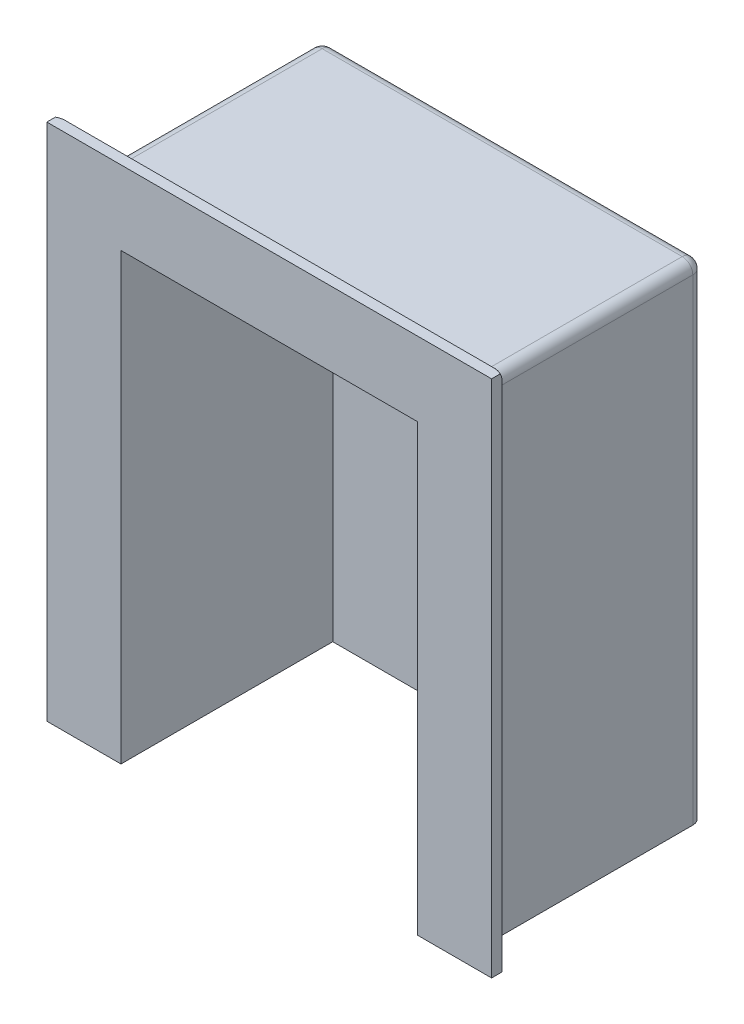
from build123d import *

# Parameters (mm, degrees)
SKETCH1_W           = 14
SKETCH1_H           = 21
BOSS_EXTRUDE1_DEPTH = 1.5
BOSS_EXTRUDE2_DEPTH = 11.5
BOSS_EXTRUDE3_DEPTH = 0.5
CHAMFER1_SIZE       = 1.5
FILLET1_R           = 0.5


# Some blends are built 0.0001 mm under size
with BuildPart() as part:
    # Sketch1 → Boss-Extrude1 (new body)
    with BuildSketch(Plane.XY):
        Rectangle(SKETCH1_W, SKETCH1_H)
    extrude(amount=BOSS_EXTRUDE1_DEPTH)

    # Sketch1<4> → Boss-Extrude2 (add)
    with BuildSketch(Plane.XY):
        Polygon((-9, 12.5), (-9, -10.5), (-7, -10.5), (-7, 10.5), (7, 10.5), (7, -10.5), (9, -10.5), (9, 12.5), align=None)
    extrude(amount=BOSS_EXTRUDE2_DEPTH)

    # Sketch2 → Boss-Extrude3 (add)
    with BuildSketch(Plane.XY.offset(11.5)):
        Polygon((-9, -10.5), (-9, 12.5), (9, 12.5), (9, -10.5), (10.5, -10.5), (10.5, 14), (-10.5, 14), (-10.5, -10.5), align=None)
    extrude(amount=-BOSS_EXTRUDE3_DEPTH)

    # Chamfer1
    chamfer1_edges = [part.edges().sort_by_distance(p)[0] for p in [
        (-9, 1, 11),
        (0, 12.5, 11),
        (9, 1, 11),
    ]]
    chamfer(chamfer1_edges, length=CHAMFER1_SIZE - 0.0001)  # a hair under: the kernel refuses the full size

    # Fillet1
    # the kernel refuses this fillet: 0.5 mm, written as the material it takes off along each edge
    with BuildSketch(Plane(origin=(8.5, 12, 0.5), x_dir=(0, 0, -1), z_dir=(0, 1, 0))) as fillet1_piece_1_section:
        Polygon((0, 0), (FILLET1_R * 1.02, 0), (FILLET1_R * 1.02, -FILLET1_R * 1.02), (0, -FILLET1_R * 1.02), align=None)
    fillet1_piece_1 = extrude(amount=FILLET1_R * 1.02, mode=Mode.PRIVATE)
    fillet1_piece_1 = fillet1_piece_1 - Plane(origin=(8.5, 12, 0.5), x_dir=(-0.7071067811865475, 0, 0.7071067811865475), z_dir=(0, 1, 0)) * Sphere(FILLET1_R, mode=Mode.PRIVATE)
    add(fillet1_piece_1, mode=Mode.SUBTRACT)
    with BuildSketch(Plane(origin=(-8.5, 12, 0.5), x_dir=(0, 0, -1), z_dir=(-1, 0, 0))) as fillet1_piece_2_section:
        Polygon((0, 0), (FILLET1_R * 1.02, 0), (FILLET1_R * 1.02, -FILLET1_R * 1.02), (0, -FILLET1_R * 1.02), align=None)
    fillet1_piece_2 = extrude(amount=FILLET1_R * 1.02, mode=Mode.PRIVATE)
    fillet1_piece_2 = fillet1_piece_2 - Plane(origin=(-8.5, 12, 0.5), x_dir=(0, -0.7071067811865475, 0.7071067811865475), z_dir=(-1, 0, 0)) * Sphere(FILLET1_R, mode=Mode.PRIVATE)
    add(fillet1_piece_2, mode=Mode.SUBTRACT)
    with BuildSketch(Plane(origin=(9, -11.75, 0), x_dir=(-1, 0, 0), z_dir=(0, 1, 0))) as fillet1_piece_3:
        with BuildLine():
            CenterArc((FILLET1_R, FILLET1_R), FILLET1_R, 180, 90)
            Line((0, FILLET1_R), (-FILLET1_R * 0.02, FILLET1_R))
            Line((-FILLET1_R * 0.02, FILLET1_R), (-FILLET1_R * 0.02, -FILLET1_R * 0.02))
            Line((-FILLET1_R * 0.02, -FILLET1_R * 0.02), (FILLET1_R, -FILLET1_R * 0.02))
            Line((FILLET1_R, -FILLET1_R * 0.02), (FILLET1_R, 0))
        make_face()
    extrude(amount=23.75, mode=Mode.SUBTRACT)
    with BuildSketch(Plane(origin=(-9, 12, 0), x_dir=(0, 0, 1), z_dir=(0, -1, 0))) as fillet1_piece_4:
        with BuildLine():
            CenterArc((FILLET1_R, -FILLET1_R), FILLET1_R, 90, 90)
            Line((0, -FILLET1_R), (-FILLET1_R * 0.02, -FILLET1_R))
            Line((-FILLET1_R * 0.02, -FILLET1_R), (-FILLET1_R * 0.02, FILLET1_R * 0.02))
            Line((-FILLET1_R * 0.02, FILLET1_R * 0.02), (FILLET1_R, FILLET1_R * 0.02))
            Line((FILLET1_R, FILLET1_R * 0.02), (FILLET1_R, 0))
        make_face()
    extrude(amount=23.75, mode=Mode.SUBTRACT)
    with BuildSketch(Plane(origin=(8.5, 12.5, 0), x_dir=(0, -1, 0), z_dir=(-1, 0, 0))) as fillet1_piece_5:
        with BuildLine():
            CenterArc((FILLET1_R, FILLET1_R), FILLET1_R, 180, 90)
            Line((0, FILLET1_R), (-FILLET1_R * 0.02, FILLET1_R))
            Line((-FILLET1_R * 0.02, FILLET1_R), (-FILLET1_R * 0.02, -FILLET1_R * 0.02))
            Line((-FILLET1_R * 0.02, -FILLET1_R * 0.02), (FILLET1_R, -FILLET1_R * 0.02))
            Line((FILLET1_R, -FILLET1_R * 0.02), (FILLET1_R, 0))
        make_face()
    extrude(amount=17, mode=Mode.SUBTRACT)
    with BuildSketch(Plane(origin=(-9, 12.5, 0.5), x_dir=(0, -1, 0), z_dir=(0, 0, 1))) as fillet1_piece_6_section:
        with BuildLine():
            CenterArc((FILLET1_R, FILLET1_R), FILLET1_R, 180, 90)
            Line((0, FILLET1_R), (-FILLET1_R * 0.02, FILLET1_R))
            Line((-FILLET1_R * 0.02, FILLET1_R), (-FILLET1_R * 0.02, -FILLET1_R * 0.02))
            Line((-FILLET1_R * 0.02, -FILLET1_R * 0.02), (FILLET1_R, -FILLET1_R * 0.02))
            Line((FILLET1_R, -FILLET1_R * 0.02), (FILLET1_R, 0))
        make_face()
    fillet1_piece_6 = extrude(amount=10.2501, mode=Mode.PRIVATE)
    fillet1_piece_6 = split(fillet1_piece_6, bisect_by=Plane(origin=(-6.646616443, 12.387329395, 7.146716443), z_dir=(-0.7071067811865476, 0, -0.7071067811865476)), keep=Keep.TOP, mode=Mode.PRIVATE)
    fillet1_piece_6 = split(fillet1_piece_6, bisect_by=Plane(origin=(-8.887329395, 10.146616443, 7.146716443), z_dir=(0, 0.7071067811865476, -0.7071067811865476)), keep=Keep.TOP, mode=Mode.PRIVATE)
    add(fillet1_piece_6, mode=Mode.SUBTRACT)
    with BuildSketch(Plane(origin=(-9, 12.5, 0.5), x_dir=(0, -1, 0), z_dir=(0, 0, 1))) as fillet1_piece_7_section:
        with BuildLine():
            CenterArc((FILLET1_R, FILLET1_R), FILLET1_R, 180, 90)
            Line((0, FILLET1_R), (-FILLET1_R * 0.02, FILLET1_R))
            Line((-FILLET1_R * 0.02, FILLET1_R), (-FILLET1_R * 0.02, -FILLET1_R * 0.02))
            Line((-FILLET1_R * 0.02, -FILLET1_R * 0.02), (FILLET1_R, -FILLET1_R * 0.02))
            Line((FILLET1_R, -FILLET1_R * 0.02), (FILLET1_R, 0))
        make_face()
    fillet1_piece_7 = extrude(amount=10.2501, mode=Mode.PRIVATE)
    fillet1_piece_7 = split(fillet1_piece_7, bisect_by=Plane(origin=(-8.796279433, 12.478509021, 9.296379433), z_dir=(0.7071067811865476, 0, 0.7071067811865476)), keep=Keep.TOP, mode=Mode.PRIVATE)
    fillet1_piece_7 = split(fillet1_piece_7, bisect_by=Plane(origin=(-8.735536236, 12.417765825, 9.417865825), z_dir=(0, 0.7071067811865476, -0.7071067811865476)), keep=Keep.TOP, mode=Mode.PRIVATE)
    add(fillet1_piece_7, mode=Mode.SUBTRACT)
    with BuildSketch(Plane(origin=(-9, 12.5, 0.5), x_dir=(0, -1, 0), z_dir=(0, 0, 1))) as fillet1_piece_8_section:
        with BuildLine():
            CenterArc((FILLET1_R, FILLET1_R), FILLET1_R, 180, 90)
            Line((0, FILLET1_R), (-FILLET1_R * 0.02, FILLET1_R))
            Line((-FILLET1_R * 0.02, FILLET1_R), (-FILLET1_R * 0.02, -FILLET1_R * 0.02))
            Line((-FILLET1_R * 0.02, -FILLET1_R * 0.02), (FILLET1_R, -FILLET1_R * 0.02))
            Line((FILLET1_R, -FILLET1_R * 0.02), (FILLET1_R, 0))
        make_face()
    fillet1_piece_8 = extrude(amount=10.2501, mode=Mode.PRIVATE)
    fillet1_piece_8 = split(fillet1_piece_8, bisect_by=Plane(origin=(-8.917765825, 12.235536236, 9.417865825), z_dir=(-0.7071067811865476, 0, -0.7071067811865476)), keep=Keep.TOP, mode=Mode.PRIVATE)
    fillet1_piece_8 = split(fillet1_piece_8, bisect_by=Plane(origin=(-8.978509021, 12.296279433, 9.296379433), z_dir=(0, -0.7071067811865476, 0.7071067811865476)), keep=Keep.TOP, mode=Mode.PRIVATE)
    add(fillet1_piece_8, mode=Mode.SUBTRACT)
    with BuildSketch(Plane(origin=(9, 12.5, 0.5), x_dir=(0, -1, 0), z_dir=(0, 0, 1))) as fillet1_piece_9_section:
        with BuildLine():
            CenterArc((FILLET1_R, -FILLET1_R), FILLET1_R, 90, 90)
            Line((0, -FILLET1_R), (-FILLET1_R * 0.02, -FILLET1_R))
            Line((-FILLET1_R * 0.02, -FILLET1_R), (-FILLET1_R * 0.02, FILLET1_R * 0.02))
            Line((-FILLET1_R * 0.02, FILLET1_R * 0.02), (FILLET1_R, FILLET1_R * 0.02))
            Line((FILLET1_R, FILLET1_R * 0.02), (FILLET1_R, 0))
        make_face()
    fillet1_piece_9 = extrude(amount=10.2501, mode=Mode.PRIVATE)
    fillet1_piece_9 = split(fillet1_piece_9, bisect_by=Plane(origin=(6.646616443, 12.387329395, 7.146716443), z_dir=(0.7071067811865476, 0, -0.7071067811865476)), keep=Keep.TOP, mode=Mode.PRIVATE)
    fillet1_piece_9 = split(fillet1_piece_9, bisect_by=Plane(origin=(8.887329395, 10.146616443, 7.146716443), z_dir=(0, 0.7071067811865476, -0.7071067811865476)), keep=Keep.TOP, mode=Mode.PRIVATE)
    add(fillet1_piece_9, mode=Mode.SUBTRACT)
    with BuildSketch(Plane(origin=(9, 12.5, 0.5), x_dir=(0, -1, 0), z_dir=(0, 0, 1))) as fillet1_piece_10_section:
        with BuildLine():
            CenterArc((FILLET1_R, -FILLET1_R), FILLET1_R, 90, 90)
            Line((0, -FILLET1_R), (-FILLET1_R * 0.02, -FILLET1_R))
            Line((-FILLET1_R * 0.02, -FILLET1_R), (-FILLET1_R * 0.02, FILLET1_R * 0.02))
            Line((-FILLET1_R * 0.02, FILLET1_R * 0.02), (FILLET1_R, FILLET1_R * 0.02))
            Line((FILLET1_R, FILLET1_R * 0.02), (FILLET1_R, 0))
        make_face()
    fillet1_piece_10 = extrude(amount=10.2501, mode=Mode.PRIVATE)
    fillet1_piece_10 = split(fillet1_piece_10, bisect_by=Plane(origin=(8.796279433, 12.478509021, 9.296379433), z_dir=(-0.7071067811865476, 0, 0.7071067811865476)), keep=Keep.TOP, mode=Mode.PRIVATE)
    fillet1_piece_10 = split(fillet1_piece_10, bisect_by=Plane(origin=(8.735536236, 12.417765825, 9.417865825), z_dir=(0, 0.7071067811865476, -0.7071067811865476)), keep=Keep.TOP, mode=Mode.PRIVATE)
    add(fillet1_piece_10, mode=Mode.SUBTRACT)
    with BuildSketch(Plane(origin=(9, 12.5, 0.5), x_dir=(0, -1, 0), z_dir=(0, 0, 1))) as fillet1_piece_11_section:
        with BuildLine():
            CenterArc((FILLET1_R, -FILLET1_R), FILLET1_R, 90, 90)
            Line((0, -FILLET1_R), (-FILLET1_R * 0.02, -FILLET1_R))
            Line((-FILLET1_R * 0.02, -FILLET1_R), (-FILLET1_R * 0.02, FILLET1_R * 0.02))
            Line((-FILLET1_R * 0.02, FILLET1_R * 0.02), (FILLET1_R, FILLET1_R * 0.02))
            Line((FILLET1_R, FILLET1_R * 0.02), (FILLET1_R, 0))
        make_face()
    fillet1_piece_11 = extrude(amount=10.2501, mode=Mode.PRIVATE)
    fillet1_piece_11 = split(fillet1_piece_11, bisect_by=Plane(origin=(8.917765825, 12.235536236, 9.417865825), z_dir=(0.7071067811865476, 0, -0.7071067811865476)), keep=Keep.TOP, mode=Mode.PRIVATE)
    fillet1_piece_11 = split(fillet1_piece_11, bisect_by=Plane(origin=(8.978509021, 12.296279433, 9.296379433), z_dir=(0, -0.7071067811865476, 0.7071067811865476)), keep=Keep.TOP, mode=Mode.PRIVATE)
    add(fillet1_piece_11, mode=Mode.SUBTRACT)
    with BuildSketch(Plane(origin=(8.583333333, 12.083333333, 9.083433333), x_dir=(0.408248290463863, -0.816496580927726, 0.408248290463863), z_dir=(0.5773502691896258, 0.5773502691896258, 0.5773502691896258))) as fillet1_piece_12_section:
        with BuildLine():
            CenterArc((FILLET1_R * 0.57735026919, -FILLET1_R), FILLET1_R, 90, 60)
            Line((-FILLET1_R * 0.288675134595, -FILLET1_R * 0.5), (-FILLET1_R * 0.305995642671, -FILLET1_R * 0.49))
            Line((-FILLET1_R * 0.305995642671, -FILLET1_R * 0.49), (-FILLET1_R * 0.0115470053838, FILLET1_R * 0.02))
            Line((-FILLET1_R * 0.0115470053838, FILLET1_R * 0.02), (FILLET1_R * 0.57735026919, FILLET1_R * 0.02))
            Line((FILLET1_R * 0.57735026919, FILLET1_R * 0.02), (FILLET1_R * 0.57735026919, 0))
        make_face()
    fillet1_piece_12 = extrude(amount=4.041278679, mode=Mode.PRIVATE)
    fillet1_piece_12 = split(fillet1_piece_12, bisect_by=Plane(origin=(9, 12.593724218, 9.60103013), z_dir=(-1, 0, 0)), keep=Keep.TOP, mode=Mode.PRIVATE)
    fillet1_piece_12 = split(fillet1_piece_12, bisect_by=Plane(origin=(8.906275782, 12.5, 9.60103013), z_dir=(0, 1, 0)), keep=Keep.TOP, mode=Mode.PRIVATE)
    add(fillet1_piece_12, mode=Mode.SUBTRACT)
    with BuildSketch(Plane(origin=(8.583333333, 12.083333333, 9.083433333), x_dir=(0.408248290463863, -0.816496580927726, 0.408248290463863), z_dir=(0.5773502691896258, 0.5773502691896258, 0.5773502691896258))) as fillet1_piece_13_section:
        with BuildLine():
            CenterArc((FILLET1_R * 0.57735026919, -FILLET1_R), FILLET1_R, 90, 60)
            Line((-FILLET1_R * 0.288675134595, -FILLET1_R * 0.5), (-FILLET1_R * 0.305995642671, -FILLET1_R * 0.49))
            Line((-FILLET1_R * 0.305995642671, -FILLET1_R * 0.49), (-FILLET1_R * 0.0115470053838, FILLET1_R * 0.02))
            Line((-FILLET1_R * 0.0115470053838, FILLET1_R * 0.02), (FILLET1_R * 0.57735026919, FILLET1_R * 0.02))
            Line((FILLET1_R * 0.57735026919, FILLET1_R * 0.02), (FILLET1_R * 0.57735026919, 0))
        make_face()
    fillet1_piece_13 = extrude(amount=4.041278679, mode=Mode.PRIVATE)
    fillet1_piece_13 = split(fillet1_piece_13, bisect_by=Plane(origin=(9, 12.406275782, 9.60103013), z_dir=(1, 0, 0)), keep=Keep.TOP, mode=Mode.PRIVATE)
    fillet1_piece_13 = split(fillet1_piece_13, bisect_by=Plane(origin=(9.093724218, 12.5, 9.60103013), z_dir=(0, -1, 0)), keep=Keep.TOP, mode=Mode.PRIVATE)
    add(fillet1_piece_13, mode=Mode.SUBTRACT)
    with BuildSketch(Plane(origin=(8.583333333, 12.083333333, 9.083433333), x_dir=(0.408248290463863, -0.816496580927726, 0.408248290463863), z_dir=(0.5773502691896258, 0.5773502691896258, 0.5773502691896258))) as fillet1_piece_14_section:
        with BuildLine():
            CenterArc((FILLET1_R * 0.57735026919, -FILLET1_R), FILLET1_R, 90, 60)
            Line((-FILLET1_R * 0.288675134595, -FILLET1_R * 0.5), (-FILLET1_R * 0.305995642671, -FILLET1_R * 0.49))
            Line((-FILLET1_R * 0.305995642671, -FILLET1_R * 0.49), (-FILLET1_R * 0.0115470053838, FILLET1_R * 0.02))
            Line((-FILLET1_R * 0.0115470053838, FILLET1_R * 0.02), (FILLET1_R * 0.57735026919, FILLET1_R * 0.02))
            Line((FILLET1_R * 0.57735026919, FILLET1_R * 0.02), (FILLET1_R * 0.57735026919, 0))
        make_face()
    fillet1_piece_14 = extrude(amount=4.041278679, mode=Mode.PRIVATE)
    fillet1_piece_14 = split(fillet1_piece_14, bisect_by=Plane(origin=(9.74076552, 13.24076552, 11), z_dir=(0, 0, -1)), keep=Keep.TOP, mode=Mode.PRIVATE)
    fillet1_piece_14 = split(fillet1_piece_14, bisect_by=Plane(origin=(9, 13.24076552, 10.315388184), z_dir=(1, 0, 0)), keep=Keep.TOP, mode=Mode.PRIVATE)
    fillet1_piece_14 = split(fillet1_piece_14, bisect_by=Plane(origin=(9.74076552, 12.5, 10.315388184), z_dir=(0, 1, 0)), keep=Keep.TOP, mode=Mode.PRIVATE)
    add(fillet1_piece_14, mode=Mode.SUBTRACT)
    with BuildSketch(Plane(origin=(8.583333333, 12.083333333, 9.083433333), x_dir=(0.408248290463863, -0.816496580927726, 0.408248290463863), z_dir=(0.5773502691896258, 0.5773502691896258, 0.5773502691896258))) as fillet1_piece_15_section:
        with BuildLine():
            CenterArc((FILLET1_R * 0.57735026919, -FILLET1_R), FILLET1_R, 90, 60)
            Line((-FILLET1_R * 0.288675134595, -FILLET1_R * 0.5), (-FILLET1_R * 0.305995642671, -FILLET1_R * 0.49))
            Line((-FILLET1_R * 0.305995642671, -FILLET1_R * 0.49), (-FILLET1_R * 0.0115470053838, FILLET1_R * 0.02))
            Line((-FILLET1_R * 0.0115470053838, FILLET1_R * 0.02), (FILLET1_R * 0.57735026919, FILLET1_R * 0.02))
            Line((FILLET1_R * 0.57735026919, FILLET1_R * 0.02), (FILLET1_R * 0.57735026919, 0))
        make_face()
    fillet1_piece_15 = extrude(amount=4.041278679, mode=Mode.PRIVATE)
    fillet1_piece_15 = split(fillet1_piece_15, bisect_by=Plane(origin=(10.655826111, 14.155826111, 11), z_dir=(0, 0, 1)), keep=Keep.TOP, mode=Mode.PRIVATE)
    add(fillet1_piece_15, mode=Mode.SUBTRACT)
    with BuildSketch(Plane(origin=(-10.916566667, 14.416566667, 11.416666667), x_dir=(-0.40824829046386607, -0.816496580927726, 0.4082482904638599), z_dir=(0.5773502691896258, -0.5773502691896258, -0.5773502691896258))) as fillet1_piece_16_section:
        with BuildLine():
            CenterArc((FILLET1_R * 0.57735026919, -FILLET1_R), FILLET1_R, 90, 60)
            Line((-FILLET1_R * 0.288675134595, -FILLET1_R * 0.5), (-FILLET1_R * 0.305995642671, -FILLET1_R * 0.49))
            Line((-FILLET1_R * 0.305995642671, -FILLET1_R * 0.49), (-FILLET1_R * 0.0115470053838, FILLET1_R * 0.02))
            Line((-FILLET1_R * 0.0115470053838, FILLET1_R * 0.02), (FILLET1_R * 0.57735026919, FILLET1_R * 0.02))
            Line((FILLET1_R * 0.57735026919, FILLET1_R * 0.02), (FILLET1_R * 0.57735026919, 0))
        make_face()
    fillet1_piece_16 = extrude(amount=4.041278679, mode=Mode.PRIVATE)
    fillet1_piece_16 = split(fillet1_piece_16, bisect_by=Plane(origin=(-10.655826111, 14.155826111, 11), z_dir=(0, 0, 1)), keep=Keep.TOP, mode=Mode.PRIVATE)
    add(fillet1_piece_16, mode=Mode.SUBTRACT)
    with BuildSketch(Plane(origin=(-10.916566667, 14.416566667, 11.416666667), x_dir=(-0.40824829046386607, -0.816496580927726, 0.4082482904638599), z_dir=(0.5773502691896258, -0.5773502691896258, -0.5773502691896258))) as fillet1_piece_17_section:
        with BuildLine():
            CenterArc((FILLET1_R * 0.57735026919, -FILLET1_R), FILLET1_R, 90, 60)
            Line((-FILLET1_R * 0.288675134595, -FILLET1_R * 0.5), (-FILLET1_R * 0.305995642671, -FILLET1_R * 0.49))
            Line((-FILLET1_R * 0.305995642671, -FILLET1_R * 0.49), (-FILLET1_R * 0.0115470053838, FILLET1_R * 0.02))
            Line((-FILLET1_R * 0.0115470053838, FILLET1_R * 0.02), (FILLET1_R * 0.57735026919, FILLET1_R * 0.02))
            Line((FILLET1_R * 0.57735026919, FILLET1_R * 0.02), (FILLET1_R * 0.57735026919, 0))
        make_face()
    fillet1_piece_17 = extrude(amount=4.041278679, mode=Mode.PRIVATE)
    fillet1_piece_17 = split(fillet1_piece_17, bisect_by=Plane(origin=(-9, 13.24076552, 10.315388184), z_dir=(-1, 0, 0)), keep=Keep.TOP, mode=Mode.PRIVATE)
    fillet1_piece_17 = split(fillet1_piece_17, bisect_by=Plane(origin=(-9.74076552, 13.24076552, 11), z_dir=(0, 0, -1)), keep=Keep.TOP, mode=Mode.PRIVATE)
    fillet1_piece_17 = split(fillet1_piece_17, bisect_by=Plane(origin=(-9.74076552, 12.5, 10.315388184), z_dir=(0, 1, 0)), keep=Keep.TOP, mode=Mode.PRIVATE)
    add(fillet1_piece_17, mode=Mode.SUBTRACT)
    with BuildSketch(Plane(origin=(-10.916566667, 14.416566667, 11.416666667), x_dir=(-0.40824829046386607, -0.816496580927726, 0.4082482904638599), z_dir=(0.5773502691896258, -0.5773502691896258, -0.5773502691896258))) as fillet1_piece_18_section:
        with BuildLine():
            CenterArc((FILLET1_R * 0.57735026919, -FILLET1_R), FILLET1_R, 90, 60)
            Line((-FILLET1_R * 0.288675134595, -FILLET1_R * 0.5), (-FILLET1_R * 0.305995642671, -FILLET1_R * 0.49))
            Line((-FILLET1_R * 0.305995642671, -FILLET1_R * 0.49), (-FILLET1_R * 0.0115470053838, FILLET1_R * 0.02))
            Line((-FILLET1_R * 0.0115470053838, FILLET1_R * 0.02), (FILLET1_R * 0.57735026919, FILLET1_R * 0.02))
            Line((FILLET1_R * 0.57735026919, FILLET1_R * 0.02), (FILLET1_R * 0.57735026919, 0))
        make_face()
    fillet1_piece_18 = extrude(amount=4.041278679, mode=Mode.PRIVATE)
    fillet1_piece_18 = split(fillet1_piece_18, bisect_by=Plane(origin=(-9, 12.593724218, 9.60103013), z_dir=(1, 0, 0)), keep=Keep.TOP, mode=Mode.PRIVATE)
    fillet1_piece_18 = split(fillet1_piece_18, bisect_by=Plane(origin=(-8.906275782, 12.5, 9.60103013), z_dir=(0, 1, 0)), keep=Keep.TOP, mode=Mode.PRIVATE)
    add(fillet1_piece_18, mode=Mode.SUBTRACT)
    with BuildSketch(Plane(origin=(-10.916566667, 14.416566667, 11.416666667), x_dir=(-0.40824829046386607, -0.816496580927726, 0.4082482904638599), z_dir=(0.5773502691896258, -0.5773502691896258, -0.5773502691896258))) as fillet1_piece_19_section:
        with BuildLine():
            CenterArc((FILLET1_R * 0.57735026919, -FILLET1_R), FILLET1_R, 90, 60)
            Line((-FILLET1_R * 0.288675134595, -FILLET1_R * 0.5), (-FILLET1_R * 0.305995642671, -FILLET1_R * 0.49))
            Line((-FILLET1_R * 0.305995642671, -FILLET1_R * 0.49), (-FILLET1_R * 0.0115470053838, FILLET1_R * 0.02))
            Line((-FILLET1_R * 0.0115470053838, FILLET1_R * 0.02), (FILLET1_R * 0.57735026919, FILLET1_R * 0.02))
            Line((FILLET1_R * 0.57735026919, FILLET1_R * 0.02), (FILLET1_R * 0.57735026919, 0))
        make_face()
    fillet1_piece_19 = extrude(amount=4.041278679, mode=Mode.PRIVATE)
    fillet1_piece_19 = split(fillet1_piece_19, bisect_by=Plane(origin=(-9, 12.406275782, 9.60103013), z_dir=(-1, 0, 0)), keep=Keep.TOP, mode=Mode.PRIVATE)
    fillet1_piece_19 = split(fillet1_piece_19, bisect_by=Plane(origin=(-9.093724218, 12.5, 9.60103013), z_dir=(0, -1, 0)), keep=Keep.TOP, mode=Mode.PRIVATE)
    add(fillet1_piece_19, mode=Mode.SUBTRACT)
    with BuildSketch(Plane(origin=(-9, 12.5, 0.5), x_dir=(0, -1, 0), z_dir=(0, 0, 1))) as fillet1_piece_20a_section:
        with BuildLine():
            CenterArc((FILLET1_R, FILLET1_R), FILLET1_R, 180, 90)
            Line((0, FILLET1_R), (-FILLET1_R * 0.02, FILLET1_R))
            Line((-FILLET1_R * 0.02, FILLET1_R), (-FILLET1_R * 0.02, -FILLET1_R * 0.02))
            Line((-FILLET1_R * 0.02, -FILLET1_R * 0.02), (FILLET1_R, -FILLET1_R * 0.02))
            Line((FILLET1_R, -FILLET1_R * 0.02), (FILLET1_R, 0))
        make_face()
    fillet1_piece_20a = extrude(amount=10.2501, mode=Mode.PRIVATE)
    fillet1_piece_20a = split(fillet1_piece_20a, bisect_by=Plane(origin=(-9.246323412, 12.386715356, 9.746423412), z_dir=(0.7071067811865476, 0, 0.7071067811865476)), keep=Keep.TOP, mode=Mode.PRIVATE)
    fillet1_piece_20a = split(fillet1_piece_20a, bisect_by=Plane(origin=(-8.886715356, 12.746323412, 9.746423412), z_dir=(0, -0.7071067811865476, 0.7071067811865476)), keep=Keep.TOP, mode=Mode.PRIVATE)
    with BuildSketch(Plane(origin=(-10.916566667, 14.416566667, 11.416666667), x_dir=(-0.40824829046386607, -0.816496580927726, 0.4082482904638599), z_dir=(0.5773502691896258, -0.5773502691896258, -0.5773502691896258))) as fillet1_piece_20b_section:
        with BuildLine():
            CenterArc((FILLET1_R * 0.57735026919, -FILLET1_R), FILLET1_R, 90, 60)
            Line((-FILLET1_R * 0.288675134595, -FILLET1_R * 0.5), (-FILLET1_R * 0.305995642671, -FILLET1_R * 0.49))
            Line((-FILLET1_R * 0.305995642671, -FILLET1_R * 0.49), (-FILLET1_R * 0.0115470053838, FILLET1_R * 0.02))
            Line((-FILLET1_R * 0.0115470053838, FILLET1_R * 0.02), (FILLET1_R * 0.57735026919, FILLET1_R * 0.02))
            Line((FILLET1_R * 0.57735026919, FILLET1_R * 0.02), (FILLET1_R * 0.57735026919, 0))
        make_face()
    fillet1_piece_20b = extrude(amount=4.041278679, mode=Mode.PRIVATE)
    fillet1_piece_20b = split(fillet1_piece_20b, bisect_by=Plane(origin=(-9, 12.25202237, 9.326225221), z_dir=(1, 0, 0)), keep=Keep.TOP, mode=Mode.PRIVATE)
    fillet1_piece_20b = split(fillet1_piece_20b, bisect_by=Plane(origin=(-8.75202237, 12.5, 9.326225221), z_dir=(0, -1, 0)), keep=Keep.TOP, mode=Mode.PRIVATE)
    fillet1_piece_20 = fillet1_piece_20a & fillet1_piece_20b
    add(fillet1_piece_20, mode=Mode.SUBTRACT)
    with BuildSketch(Plane(origin=(9, 12.5, 0.5), x_dir=(0, -1, 0), z_dir=(0, 0, 1))) as fillet1_piece_21a_section:
        with BuildLine():
            CenterArc((FILLET1_R, -FILLET1_R), FILLET1_R, 90, 90)
            Line((0, -FILLET1_R), (-FILLET1_R * 0.02, -FILLET1_R))
            Line((-FILLET1_R * 0.02, -FILLET1_R), (-FILLET1_R * 0.02, FILLET1_R * 0.02))
            Line((-FILLET1_R * 0.02, FILLET1_R * 0.02), (FILLET1_R, FILLET1_R * 0.02))
            Line((FILLET1_R, FILLET1_R * 0.02), (FILLET1_R, 0))
        make_face()
    fillet1_piece_21a = extrude(amount=10.2501, mode=Mode.PRIVATE)
    fillet1_piece_21a = split(fillet1_piece_21a, bisect_by=Plane(origin=(9.246323412, 12.386715356, 9.746423412), z_dir=(-0.7071067811865476, 0, 0.7071067811865476)), keep=Keep.TOP, mode=Mode.PRIVATE)
    fillet1_piece_21a = split(fillet1_piece_21a, bisect_by=Plane(origin=(8.886715356, 12.746323412, 9.746423412), z_dir=(0, -0.7071067811865476, 0.7071067811865476)), keep=Keep.TOP, mode=Mode.PRIVATE)
    with BuildSketch(Plane(origin=(8.583333333, 12.083333333, 9.083433333), x_dir=(0.408248290463863, -0.816496580927726, 0.408248290463863), z_dir=(0.5773502691896258, 0.5773502691896258, 0.5773502691896258))) as fillet1_piece_21b_section:
        with BuildLine():
            CenterArc((FILLET1_R * 0.57735026919, -FILLET1_R), FILLET1_R, 90, 60)
            Line((-FILLET1_R * 0.288675134595, -FILLET1_R * 0.5), (-FILLET1_R * 0.305995642671, -FILLET1_R * 0.49))
            Line((-FILLET1_R * 0.305995642671, -FILLET1_R * 0.49), (-FILLET1_R * 0.0115470053838, FILLET1_R * 0.02))
            Line((-FILLET1_R * 0.0115470053838, FILLET1_R * 0.02), (FILLET1_R * 0.57735026919, FILLET1_R * 0.02))
            Line((FILLET1_R * 0.57735026919, FILLET1_R * 0.02), (FILLET1_R * 0.57735026919, 0))
        make_face()
    fillet1_piece_21b = extrude(amount=4.041278679, mode=Mode.PRIVATE)
    fillet1_piece_21b = split(fillet1_piece_21b, bisect_by=Plane(origin=(9, 12.25202237, 9.326225221), z_dir=(-1, 0, 0)), keep=Keep.TOP, mode=Mode.PRIVATE)
    fillet1_piece_21b = split(fillet1_piece_21b, bisect_by=Plane(origin=(8.75202237, 12.5, 9.326225221), z_dir=(0, -1, 0)), keep=Keep.TOP, mode=Mode.PRIVATE)
    fillet1_piece_21 = fillet1_piece_21a & fillet1_piece_21b
    add(fillet1_piece_21, mode=Mode.SUBTRACT)


solid = part.part
